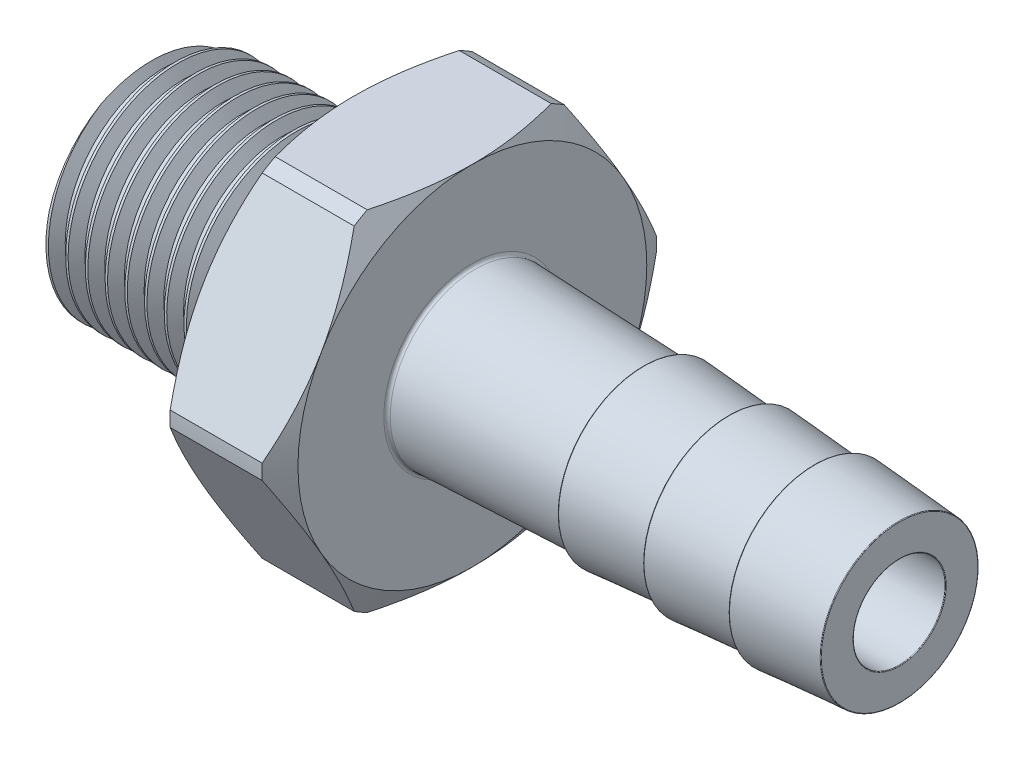
from build123d import *

# Parameters (mm, degrees)
SKETCH2_W          = 15
SKETCH2_H          = 2
THREAD1_PITCH      = 1.5
SKETCH5_OUTSIDE_W  = 46.132
SKETCH5_OUTSIDE_H  = 46.132
CUT_EXTRUDE1_DEPTH = 39.810436824
FILLET1_R          = 0.05
FILLET2_R          = 0.25
CHAMFER1_SIZE      = 2.5


with BuildPart() as part:
    # Sketch1 → Revolve1 (revolve)
    with BuildSketch(Plane(origin=(0, 0, 0), x_dir=(1, 0, 0), z_dir=(0, 1, 0)), mode=Mode.PRIVATE) as revolve1_sk:
        with BuildLine():
            Line((19, 3.5), (19, 6.5))
            Line((19, 6.5), (15, 6.5))
            Line((15, 6.5), (15, 13.267949192))
            Line((15, 13.267949192), (16, 15))
            Line((16, 15), (23, 15))
            Line((23, 15), (24, 13.267949192))
            Line((24, 13.267949192), (24, 6.5))
            Line((24, 6.5), (36.948078344, 6.001996987))
            ThreePointArc((36.948078344, 6.001996987), (36.984669275, 6.015931704), (37, 6.051960046))
            Line((37, 6.051960046), (37, 6.446006135))
            ThreePointArc((37, 6.446006135), (37.01602752, 6.482692245), (37.053834825, 6.49585886))
            Line((37.053834825, 6.49585886), (43.446165175, 6.00414114))
            ThreePointArc((43.446165175, 6.00414114), (43.48397248, 6.017307755), (43.5, 6.053993865))
            Line((43.5, 6.053993865), (43.5, 6.446006135))
            ThreePointArc((43.5, 6.446006135), (43.51602752, 6.482692245), (43.553834825, 6.49585886))
            Line((43.553834825, 6.49585886), (49.946165175, 6.00414114))
            ThreePointArc((49.946165175, 6.00414114), (49.98397248, 6.017307755), (50, 6.053993865))
            Line((50, 6.053993865), (50, 6.446006135))
            ThreePointArc((50, 6.446006135), (50.01602752, 6.482692245), (50.053834825, 6.49585886))
            Line((50.053834825, 6.49585886), (56.453834825, 6.003551167))
            ThreePointArc((56.453834825, 6.003551167), (56.486686109, 5.987670923), (56.5, 5.953698443))
            Line((56.5, 5.953698443), (56.5, 3.5))
            Line((56.5, 3.5), (19, 3.5))
        make_face()
    revolve(revolve1_sk.sketch.rotate(Axis((-23.929618611, 0, 0), (1, 0, 0)), 180), axis=Axis((-23.929618611, 0, 0), (1, 0, 0)))

    # Sketch2 → Revolve2 (revolve)
    with BuildSketch(Plane(origin=(0, 0, 0), x_dir=(1, 0, 0), z_dir=(0, 1, 0)), mode=Mode.PRIVATE) as revolve2_sk:
        with Locations((7.5, 7.5)):
            Rectangle(SKETCH2_W, SKETCH2_H)
    revolve(revolve2_sk.sketch.rotate(Axis((-23.929618611, 0, 0), (1, 0, 0)), 180), axis=Axis((-23.929618611, 0, 0), (1, 0, 0)))

    # Thread1: the profile of Thread Profile1 profile screwed along a right-hand helix of 11.333333 turns, 8 arcs to a turn; built about Z, then put on its axis
    thread1_z = Axis((0, 0, 0), (0, 0, 1))
    thread1_corners = [(8.5003, 0, -0.000173205), (8.5003, 0, 1.312673201), (7.688101187, 0, 0.843749998), (7.688101187, 0, 0.468749998)]
    with BuildLine(mode=Mode.PRIVATE) as thread1_profile:
        Line(thread1_corners[0], thread1_corners[1])
        Line(thread1_corners[1], thread1_corners[2])
        Line(thread1_corners[2], thread1_corners[3])
        Line(thread1_corners[3], thread1_corners[0])
    thread1_cap = Face(thread1_profile.wire())
    thread1_turn_angles = [0, 22.5, 45, 67.5, 90, 112.5, 135, 157.5, 180, 202.5, 225, 247.5, 270, 292.5, 315, 337.5, 360]
    thread1_turn_weights = [1, 0.9238795325112867, 1, 0.9238795325112867, 1, 0.9238795325112867, 1, 0.9238795325112867, 1, 0.9238795325112867, 1, 0.9238795325112867, 1, 0.9238795325112867, 1, 0.9238795325112867, 1]
    thread1_turn_rails = [Edge.make_bspline([Vector(p[0], p[1], 0).rotate(thread1_z, thread1_turn_angles[k]) / thread1_turn_weights[k] + Vector(0, 0, p[2] + THREAD1_PITCH * thread1_turn_angles[k] / 360) for k in range(17)], [0, 0, 0, 1, 1, 2, 2, 3, 3, 4, 4, 5, 5, 6, 6, 7, 7, 8, 8, 8], 2, thread1_turn_weights) for p in thread1_corners]
    thread1_turn_sides = [Face.make_surface_from_curves(thread1_turn_rails[p[0]], thread1_turn_rails[p[1]]) for p in [(0, 1), (1, 2), (2, 3), (3, 0)]]
    thread1_last_angles = [3960, 3982.5, 4005, 4027.5, 4050, 4065, 4080]
    thread1_last_weights = [1, 0.9238795325112867, 1, 0.9238795325112867, 1, 0.9659258262890693, 1]
    thread1_last_rails = [Edge.make_bspline([Vector(p[0], p[1], 0).rotate(thread1_z, thread1_last_angles[k]) / thread1_last_weights[k] + Vector(0, 0, p[2] + THREAD1_PITCH * thread1_last_angles[k] / 360) for k in range(7)], [0, 0, 0, 1, 1, 2, 2, 3, 3, 3], 2, thread1_last_weights) for p in thread1_corners]
    thread1_last_sides = [Face.make_surface_from_curves(thread1_last_rails[p[0]], thread1_last_rails[p[1]]) for p in [(0, 1), (1, 2), (2, 3), (3, 0)]]
    thread1 = Plane(origin=(-2, 0, 0), x_dir=(0, 0, -1), z_dir=(1, 0, 0)) * Solid(Shell([*[p.moved(Location((0, 0, THREAD1_PITCH * i))) for i in range(11) for p in thread1_turn_sides], *thread1_last_sides, thread1_cap, thread1_cap.rotate(thread1_z, 4080).moved(Location((0, 0, THREAD1_PITCH * 4080 / 360)))]))
    add(thread1, mode=Mode.SUBTRACT)

    # Sketch5 outside → Cut-Extrude1 (cut, through all)
    with BuildSketch(Plane(origin=(24, 0, 0), x_dir=(0, 0, -1), z_dir=(1, 0, 0))):
        Rectangle(SKETCH5_OUTSIDE_W, SKETCH5_OUTSIDE_H)
        Polygon((-7.660254038, 13.267949192), (-15.320508076, 0), (-7.660254038, -13.267949192), (7.660254038, -13.267949192), (15.320508076, 0), (7.660254038, 13.267949192), align=None, mode=Mode.SUBTRACT)
    extrude(amount=-CUT_EXTRUDE1_DEPTH, mode=Mode.SUBTRACT)

    # Fillet1
    fillet1_edges = [part.edges().sort_by_distance(p)[0] for p in [
        (56.5, 0, -3.5),
    ]]
    fillet(fillet1_edges, radius=FILLET1_R)

    # Fillet2
    fillet2_edges = [part.edges().sort_by_distance(p)[0] for p in [
        (19, 0, -6.5),
        (24, 0, -6.5),
    ]]
    fillet(fillet2_edges, radius=FILLET2_R)

    # Chamfer1
    chamfer1_edges = [part.edges().sort_by_distance(p)[0] for p in [
        (19, 0, -3.5),
    ]]
    chamfer(chamfer1_edges, length=CHAMFER1_SIZE)


solid = part.part
